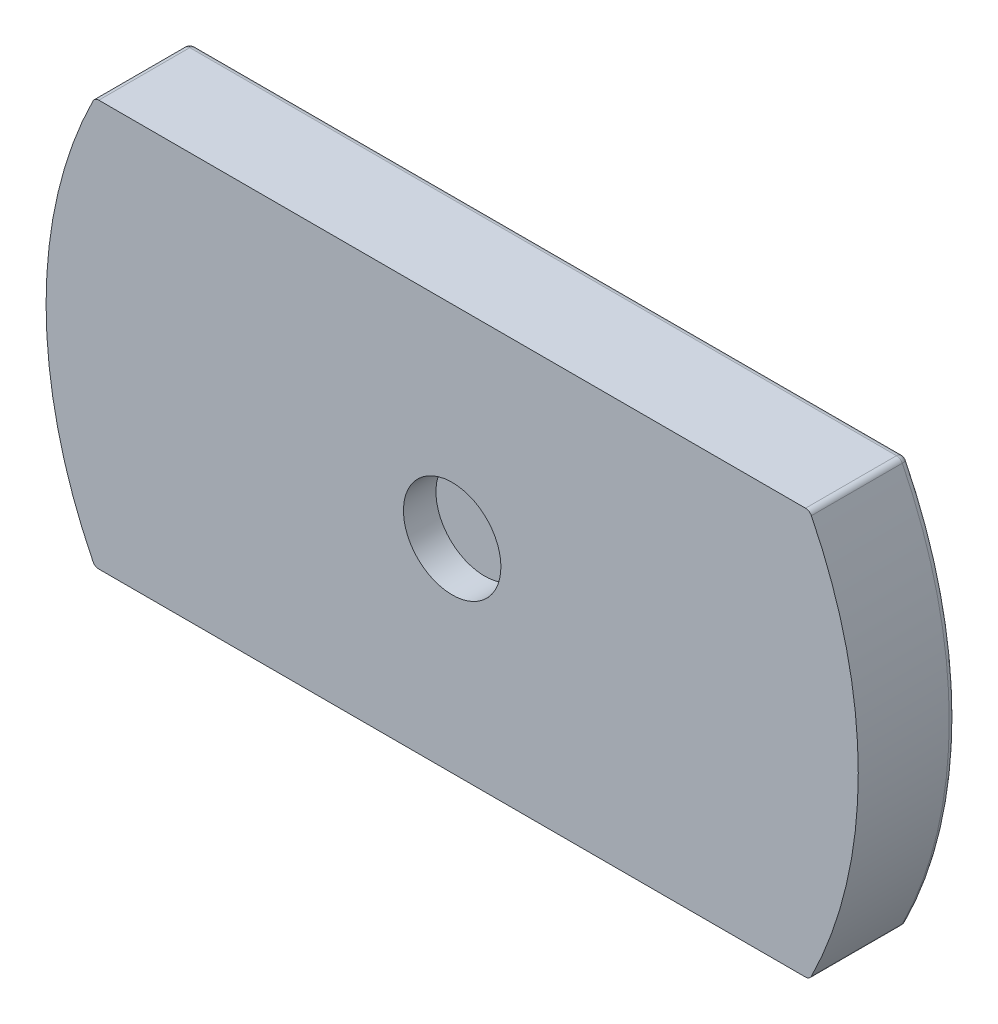
from build123d import *

# Parameters (mm, degrees)
SKETCH1_W                   = 635
SKETCH1_H                   = 317.5
BOSS_EXTRUDE2_DEPTH         = 76.2
SKETCH3_OUTSIDE_W           = 779.806
SKETCH3_OUTSIDE_H           = 462.306
CUT_EXTRUDE1_DEPTH          = 137.16
FILLET1_R                   = 5.08
SKETCH5_R                   = 6.35
CUT_EXTRUDE2_DEPTH          = 20.32
LPATTERN1_COUNT             = 18
LPATTERN1_PITCH             = 30.48
LPATTERN2_COUNT             = 9
LPATTERN2_PITCH             = 31.75
LPATTERN2_COPY_1_SKETCH_R   = 6.35
LPATTERN2_COPY_1_DEPTH      = 20.32
LPATTERN2_COPY_2_SKETCH_R   = 6.35
LPATTERN2_COPY_2_DEPTH      = 20.32
LPATTERN2_COPY_3_SKETCH_R   = 6.35
LPATTERN2_COPY_3_DEPTH      = 20.32
LPATTERN2_COPY_4_SKETCH_R   = 6.35
LPATTERN2_COPY_4_DEPTH      = 20.32
LPATTERN2_COPY_5_SKETCH_R   = 6.35
LPATTERN2_COPY_5_DEPTH      = 20.32
LPATTERN2_COPY_6_SKETCH_R   = 6.35
LPATTERN2_COPY_6_DEPTH      = 20.32
LPATTERN2_COPY_7_SKETCH_R   = 6.35
LPATTERN2_COPY_7_DEPTH      = 20.32
LPATTERN2_COPY_8_SKETCH_R   = 6.35
LPATTERN2_COPY_8_DEPTH      = 20.32
LPATTERN2_COPY_9_SKETCH_R   = 6.35
LPATTERN2_COPY_9_DEPTH      = 20.32
LPATTERN2_COPY_10_SKETCH_R  = 6.35
LPATTERN2_COPY_10_DEPTH     = 20.32
LPATTERN2_COPY_11_SKETCH_R  = 6.35
LPATTERN2_COPY_11_DEPTH     = 20.32
LPATTERN2_COPY_12_SKETCH_R  = 6.35
LPATTERN2_COPY_12_DEPTH     = 20.32
LPATTERN2_COPY_13_SKETCH_R  = 6.35
LPATTERN2_COPY_13_DEPTH     = 20.32
LPATTERN2_COPY_14_SKETCH_R  = 6.35
LPATTERN2_COPY_14_DEPTH     = 20.32
LPATTERN2_COPY_15_SKETCH_R  = 6.35
LPATTERN2_COPY_15_DEPTH     = 20.32
LPATTERN2_COPY_16_SKETCH_R  = 6.35
LPATTERN2_COPY_16_DEPTH     = 20.32
LPATTERN2_COPY_17_SKETCH_R  = 6.35
LPATTERN2_COPY_17_DEPTH     = 20.32
LPATTERN2_COPY_18_SKETCH_R  = 6.35
LPATTERN2_COPY_18_DEPTH     = 20.32
LPATTERN2_COPY_19_SKETCH_R  = 6.35
LPATTERN2_COPY_19_DEPTH     = 20.32
LPATTERN2_COPY_20_SKETCH_R  = 6.35
LPATTERN2_COPY_20_DEPTH     = 20.32
LPATTERN2_COPY_21_SKETCH_R  = 6.35
LPATTERN2_COPY_21_DEPTH     = 20.32
LPATTERN2_COPY_22_SKETCH_R  = 6.35
LPATTERN2_COPY_22_DEPTH     = 20.32
LPATTERN2_COPY_23_SKETCH_R  = 6.35
LPATTERN2_COPY_23_DEPTH     = 20.32
LPATTERN2_COPY_24_SKETCH_R  = 6.35
LPATTERN2_COPY_24_DEPTH     = 20.32
LPATTERN2_COPY_25_SKETCH_R  = 6.35
LPATTERN2_COPY_25_DEPTH     = 20.32
LPATTERN2_COPY_26_SKETCH_R  = 6.35
LPATTERN2_COPY_26_DEPTH     = 20.32
LPATTERN2_COPY_27_SKETCH_R  = 6.35
LPATTERN2_COPY_27_DEPTH     = 20.32
LPATTERN2_COPY_28_SKETCH_R  = 6.35
LPATTERN2_COPY_28_DEPTH     = 20.32
LPATTERN2_COPY_29_SKETCH_R  = 6.35
LPATTERN2_COPY_29_DEPTH     = 20.32
LPATTERN2_COPY_30_SKETCH_R  = 6.35
LPATTERN2_COPY_30_DEPTH     = 20.32
LPATTERN2_COPY_31_SKETCH_R  = 6.35
LPATTERN2_COPY_31_DEPTH     = 20.32
LPATTERN2_COPY_32_SKETCH_R  = 6.35
LPATTERN2_COPY_32_DEPTH     = 20.32
LPATTERN2_COPY_33_SKETCH_R  = 6.35
LPATTERN2_COPY_33_DEPTH     = 20.32
LPATTERN2_COPY_34_SKETCH_R  = 6.35
LPATTERN2_COPY_34_DEPTH     = 20.32
LPATTERN2_COPY_35_SKETCH_R  = 6.35
LPATTERN2_COPY_35_DEPTH     = 20.32
LPATTERN2_COPY_36_SKETCH_R  = 6.35
LPATTERN2_COPY_36_DEPTH     = 20.32
LPATTERN2_COPY_37_SKETCH_R  = 6.35
LPATTERN2_COPY_37_DEPTH     = 20.32
LPATTERN2_COPY_38_SKETCH_R  = 6.35
LPATTERN2_COPY_38_DEPTH     = 20.32
LPATTERN2_COPY_39_SKETCH_R  = 6.35
LPATTERN2_COPY_39_DEPTH     = 20.32
LPATTERN2_COPY_40_SKETCH_R  = 6.35
LPATTERN2_COPY_40_DEPTH     = 20.32
LPATTERN2_COPY_41_SKETCH_R  = 6.35
LPATTERN2_COPY_41_DEPTH     = 20.32
LPATTERN2_COPY_42_SKETCH_R  = 6.35
LPATTERN2_COPY_42_DEPTH     = 20.32
LPATTERN2_COPY_43_SKETCH_R  = 6.35
LPATTERN2_COPY_43_DEPTH     = 20.32
LPATTERN2_COPY_44_SKETCH_R  = 6.35
LPATTERN2_COPY_44_DEPTH     = 20.32
LPATTERN2_COPY_45_SKETCH_R  = 6.35
LPATTERN2_COPY_45_DEPTH     = 20.32
LPATTERN2_COPY_46_SKETCH_R  = 6.35
LPATTERN2_COPY_46_DEPTH     = 20.32
LPATTERN2_COPY_47_SKETCH_R  = 6.35
LPATTERN2_COPY_47_DEPTH     = 20.32
LPATTERN2_COPY_48_SKETCH_R  = 6.35
LPATTERN2_COPY_48_DEPTH     = 20.32
LPATTERN2_COPY_49_SKETCH_R  = 6.35
LPATTERN2_COPY_49_DEPTH     = 20.32
LPATTERN2_COPY_50_SKETCH_R  = 6.35
LPATTERN2_COPY_50_DEPTH     = 20.32
LPATTERN2_COPY_51_SKETCH_R  = 6.35
LPATTERN2_COPY_51_DEPTH     = 20.32
LPATTERN2_COPY_52_SKETCH_R  = 6.35
LPATTERN2_COPY_52_DEPTH     = 20.32
LPATTERN2_COPY_53_SKETCH_R  = 6.35
LPATTERN2_COPY_53_DEPTH     = 20.32
LPATTERN2_COPY_54_SKETCH_R  = 6.35
LPATTERN2_COPY_54_DEPTH     = 20.32
LPATTERN2_COPY_55_SKETCH_R  = 6.35
LPATTERN2_COPY_55_DEPTH     = 20.32
LPATTERN2_COPY_56_SKETCH_R  = 6.35
LPATTERN2_COPY_56_DEPTH     = 20.32
LPATTERN2_COPY_57_SKETCH_R  = 6.35
LPATTERN2_COPY_57_DEPTH     = 20.32
LPATTERN2_COPY_58_SKETCH_R  = 6.35
LPATTERN2_COPY_58_DEPTH     = 20.32
LPATTERN2_COPY_59_SKETCH_R  = 6.35
LPATTERN2_COPY_59_DEPTH     = 20.32
LPATTERN2_COPY_60_SKETCH_R  = 6.35
LPATTERN2_COPY_60_DEPTH     = 20.32
LPATTERN2_COPY_61_SKETCH_R  = 6.35
LPATTERN2_COPY_61_DEPTH     = 20.32
LPATTERN2_COPY_62_SKETCH_R  = 6.35
LPATTERN2_COPY_62_DEPTH     = 20.32
LPATTERN2_COPY_63_SKETCH_R  = 6.35
LPATTERN2_COPY_63_DEPTH     = 20.32
LPATTERN2_COPY_64_SKETCH_R  = 6.35
LPATTERN2_COPY_64_DEPTH     = 20.32
LPATTERN2_COPY_65_SKETCH_R  = 6.35
LPATTERN2_COPY_65_DEPTH     = 20.32
LPATTERN2_COPY_66_SKETCH_R  = 6.35
LPATTERN2_COPY_66_DEPTH     = 20.32
LPATTERN2_COPY_67_SKETCH_R  = 6.35
LPATTERN2_COPY_67_DEPTH     = 20.32
LPATTERN2_COPY_68_SKETCH_R  = 6.35
LPATTERN2_COPY_68_DEPTH     = 20.32
LPATTERN2_COPY_69_SKETCH_R  = 6.35
LPATTERN2_COPY_69_DEPTH     = 20.32
LPATTERN2_COPY_70_SKETCH_R  = 6.35
LPATTERN2_COPY_70_DEPTH     = 20.32
LPATTERN2_COPY_71_SKETCH_R  = 6.35
LPATTERN2_COPY_71_DEPTH     = 20.32
LPATTERN2_COPY_72_SKETCH_R  = 6.35
LPATTERN2_COPY_72_DEPTH     = 20.32
LPATTERN2_COPY_73_SKETCH_R  = 6.35
LPATTERN2_COPY_73_DEPTH     = 20.32
LPATTERN2_COPY_74_SKETCH_R  = 6.35
LPATTERN2_COPY_74_DEPTH     = 20.32
LPATTERN2_COPY_75_SKETCH_R  = 6.35
LPATTERN2_COPY_75_DEPTH     = 20.32
LPATTERN2_COPY_76_SKETCH_R  = 6.35
LPATTERN2_COPY_76_DEPTH     = 20.32
LPATTERN2_COPY_77_SKETCH_R  = 6.35
LPATTERN2_COPY_77_DEPTH     = 20.32
LPATTERN2_COPY_78_SKETCH_R  = 6.35
LPATTERN2_COPY_78_DEPTH     = 20.32
LPATTERN2_COPY_79_SKETCH_R  = 6.35
LPATTERN2_COPY_79_DEPTH     = 20.32
LPATTERN2_COPY_80_SKETCH_R  = 6.35
LPATTERN2_COPY_80_DEPTH     = 20.32
LPATTERN2_COPY_81_SKETCH_R  = 6.35
LPATTERN2_COPY_81_DEPTH     = 20.32
LPATTERN2_COPY_82_SKETCH_R  = 6.35
LPATTERN2_COPY_82_DEPTH     = 20.32
LPATTERN2_COPY_83_SKETCH_R  = 6.35
LPATTERN2_COPY_83_DEPTH     = 20.32
LPATTERN2_COPY_84_SKETCH_R  = 6.35
LPATTERN2_COPY_84_DEPTH     = 20.32
LPATTERN2_COPY_85_SKETCH_R  = 6.35
LPATTERN2_COPY_85_DEPTH     = 20.32
LPATTERN2_COPY_86_SKETCH_R  = 6.35
LPATTERN2_COPY_86_DEPTH     = 20.32
LPATTERN2_COPY_87_SKETCH_R  = 6.35
LPATTERN2_COPY_87_DEPTH     = 20.32
LPATTERN2_COPY_88_SKETCH_R  = 6.35
LPATTERN2_COPY_88_DEPTH     = 20.32
LPATTERN2_COPY_89_SKETCH_R  = 6.35
LPATTERN2_COPY_89_DEPTH     = 20.32
LPATTERN2_COPY_90_SKETCH_R  = 6.35
LPATTERN2_COPY_90_DEPTH     = 20.32
LPATTERN2_COPY_91_SKETCH_R  = 6.35
LPATTERN2_COPY_91_DEPTH     = 20.32
LPATTERN2_COPY_92_SKETCH_R  = 6.35
LPATTERN2_COPY_92_DEPTH     = 20.32
LPATTERN2_COPY_93_SKETCH_R  = 6.35
LPATTERN2_COPY_93_DEPTH     = 20.32
LPATTERN2_COPY_94_SKETCH_R  = 6.35
LPATTERN2_COPY_94_DEPTH     = 20.32
LPATTERN2_COPY_95_SKETCH_R  = 6.35
LPATTERN2_COPY_95_DEPTH     = 20.32
LPATTERN2_COPY_96_SKETCH_R  = 6.35
LPATTERN2_COPY_96_DEPTH     = 20.32
LPATTERN2_COPY_97_SKETCH_R  = 6.35
LPATTERN2_COPY_97_DEPTH     = 20.32
LPATTERN2_COPY_98_SKETCH_R  = 6.35
LPATTERN2_COPY_98_DEPTH     = 20.32
LPATTERN2_COPY_99_SKETCH_R  = 6.35
LPATTERN2_COPY_99_DEPTH     = 20.32
LPATTERN2_COPY_100_SKETCH_R = 6.35
LPATTERN2_COPY_100_DEPTH    = 20.32
LPATTERN2_COPY_101_SKETCH_R = 6.35
LPATTERN2_COPY_101_DEPTH    = 20.32
LPATTERN2_COPY_102_SKETCH_R = 6.35
LPATTERN2_COPY_102_DEPTH    = 20.32
LPATTERN2_COPY_103_SKETCH_R = 6.35
LPATTERN2_COPY_103_DEPTH    = 20.32
LPATTERN2_COPY_104_SKETCH_R = 6.35
LPATTERN2_COPY_104_DEPTH    = 20.32
LPATTERN2_COPY_105_SKETCH_R = 6.35
LPATTERN2_COPY_105_DEPTH    = 20.32
LPATTERN2_COPY_106_SKETCH_R = 6.35
LPATTERN2_COPY_106_DEPTH    = 20.32
LPATTERN2_COPY_107_SKETCH_R = 6.35
LPATTERN2_COPY_107_DEPTH    = 20.32
LPATTERN2_COPY_108_SKETCH_R = 6.35
LPATTERN2_COPY_108_DEPTH    = 20.32
LPATTERN2_COPY_109_SKETCH_R = 6.35
LPATTERN2_COPY_109_DEPTH    = 20.32
LPATTERN2_COPY_110_SKETCH_R = 6.35
LPATTERN2_COPY_110_DEPTH    = 20.32
LPATTERN2_COPY_111_SKETCH_R = 6.35
LPATTERN2_COPY_111_DEPTH    = 20.32
LPATTERN2_COPY_112_SKETCH_R = 6.35
LPATTERN2_COPY_112_DEPTH    = 20.32
LPATTERN2_COPY_113_SKETCH_R = 6.35
LPATTERN2_COPY_113_DEPTH    = 20.32
LPATTERN2_COPY_114_SKETCH_R = 6.35
LPATTERN2_COPY_114_DEPTH    = 20.32
LPATTERN2_COPY_115_SKETCH_R = 6.35
LPATTERN2_COPY_115_DEPTH    = 20.32
LPATTERN2_COPY_116_SKETCH_R = 6.35
LPATTERN2_COPY_116_DEPTH    = 20.32
LPATTERN2_COPY_117_SKETCH_R = 6.35
LPATTERN2_COPY_117_DEPTH    = 20.32
LPATTERN2_COPY_118_SKETCH_R = 6.35
LPATTERN2_COPY_118_DEPTH    = 20.32
LPATTERN2_COPY_119_SKETCH_R = 6.35
LPATTERN2_COPY_119_DEPTH    = 20.32
LPATTERN2_COPY_120_SKETCH_R = 6.35
LPATTERN2_COPY_120_DEPTH    = 20.32
LPATTERN2_COPY_121_SKETCH_R = 6.35
LPATTERN2_COPY_121_DEPTH    = 20.32
LPATTERN2_COPY_122_SKETCH_R = 6.35
LPATTERN2_COPY_122_DEPTH    = 20.32
LPATTERN2_COPY_123_SKETCH_R = 6.35
LPATTERN2_COPY_123_DEPTH    = 20.32
LPATTERN2_COPY_124_SKETCH_R = 6.35
LPATTERN2_COPY_124_DEPTH    = 20.32
LPATTERN2_COPY_125_SKETCH_R = 6.35
LPATTERN2_COPY_125_DEPTH    = 20.32
LPATTERN2_COPY_126_SKETCH_R = 6.35
LPATTERN2_COPY_126_DEPTH    = 20.32
LPATTERN2_COPY_127_SKETCH_R = 6.35
LPATTERN2_COPY_127_DEPTH    = 20.32
LPATTERN2_COPY_128_SKETCH_R = 6.35
LPATTERN2_COPY_128_DEPTH    = 20.32
LPATTERN2_COPY_129_SKETCH_R = 6.35
LPATTERN2_COPY_129_DEPTH    = 20.32
LPATTERN2_COPY_130_SKETCH_R = 6.35
LPATTERN2_COPY_130_DEPTH    = 20.32
LPATTERN2_COPY_131_SKETCH_R = 6.35
LPATTERN2_COPY_131_DEPTH    = 20.32
LPATTERN2_COPY_132_SKETCH_R = 6.35
LPATTERN2_COPY_132_DEPTH    = 20.32
LPATTERN2_COPY_133_SKETCH_R = 6.35
LPATTERN2_COPY_133_DEPTH    = 20.32
LPATTERN2_COPY_134_SKETCH_R = 6.35
LPATTERN2_COPY_134_DEPTH    = 20.32
LPATTERN2_COPY_135_SKETCH_R = 6.35
LPATTERN2_COPY_135_DEPTH    = 20.32
LPATTERN2_COPY_136_SKETCH_R = 6.35
LPATTERN2_COPY_136_DEPTH    = 20.32
CIRPATTERN1_COUNT           = 6
CIRPATTERN1_ANGLE           = 40
MIRROR1_COPY_1_SKETCH_R     = 6.35
MIRROR1_COPY_1_DEPTH        = 20.32
MIRROR1_COPY_2_SKETCH_R     = 6.35
MIRROR1_COPY_2_DEPTH        = 20.32
MIRROR1_COPY_3_SKETCH_R     = 6.35
MIRROR1_COPY_3_DEPTH        = 20.32
MIRROR1_COPY_4_SKETCH_R     = 6.35
MIRROR1_COPY_4_DEPTH        = 20.32
MIRROR1_COPY_5_SKETCH_R     = 6.35
MIRROR1_COPY_5_DEPTH        = 20.32
MIRROR1_COPY_6_SKETCH_R     = 6.35
MIRROR1_COPY_6_DEPTH        = 20.32
SKETCH8_R                   = 38.1
CUT_EXTRUDE3_DEPTH          = 25.4


with BuildPart() as part:
    # Sketch1 → Boss-Extrude2 (new body)
    with BuildSketch(Plane.XY):
        with Locations((0, 234.95)):
            Rectangle(SKETCH1_W, SKETCH1_H)
    extrude(amount=BOSS_EXTRUDE2_DEPTH)

    # Sketch3 outside → Cut-Extrude1 (cut)
    with BuildSketch(Plane.XY.offset(76.2)):
        with Locations((0, 234.95)):
            Rectangle(SKETCH3_OUTSIDE_W, SKETCH3_OUTSIDE_H)
        with BuildLine():
            Line((-279.4, 393.7), (279.4, 393.7))
            ThreePointArc((279.4, 393.7), (317.5, 234.95), (279.4, 76.2))
            Line((279.4, 76.2), (-279.4, 76.2))
            ThreePointArc((-279.4, 76.2), (-317.5, 234.95), (-279.4, 393.7))
        make_face(mode=Mode.SUBTRACT)
    extrude(amount=-CUT_EXTRUDE1_DEPTH, mode=Mode.SUBTRACT)

    # Fillet1
    fillet1_edges = [part.edges().sort_by_distance(p)[0] for p in [
        (279.4, 393.7, 38.1),
        (-279.4, 393.7, 38.1),
        (-279.4, 76.2, 38.1),
        (279.4, 76.2, 38.1),
        (-317.5, 234.95, 0),
        (0, 393.7, 0),
        (317.5, 234.95, 0),
        (0, 76.2, 0),
    ]]
    fillet(fillet1_edges, radius=FILLET1_R)

    # Sketch5 → Cut-Extrude2 (cut)
    with BuildSketch(Plane(origin=(0, 0, 0), x_dir=(-1, 0, 0), z_dir=(0, 0, -1))):
        with Locations((-260.122551752, 106.68)):
            Circle(SKETCH5_R)
    cut_extrude2 = extrude(amount=-CUT_EXTRUDE2_DEPTH, mode=Mode.SUBTRACT)

    # LPattern1: Cut-Extrude2 ×18
    with Locations(*[(-i * LPATTERN1_PITCH, 0, 0) for i in range(1, LPATTERN1_COUNT)]):
        add(cut_extrude2, mode=Mode.SUBTRACT)

    # LPattern2: Cut-Extrude2 ×9
    with Locations(*[(0, i * LPATTERN2_PITCH, 0) for i in range(1, LPATTERN2_COUNT)]):
        add(cut_extrude2, mode=Mode.SUBTRACT)

    # LPattern2 copy 1 sketch → LPattern2 copy 1 (cut)
    with BuildSketch(Plane(origin=(-30.48, 31.75, 0), x_dir=(-1, 0, 0), z_dir=(0, 0, -1))):
        with Locations((-260.122551752, 106.68)):
            Circle(LPATTERN2_COPY_1_SKETCH_R)
    extrude(amount=-LPATTERN2_COPY_1_DEPTH, mode=Mode.SUBTRACT)

    # LPattern2 copy 2 sketch → LPattern2 copy 2 (cut)
    with BuildSketch(Plane(origin=(-30.48, 63.5, 0), x_dir=(-1, 0, 0), z_dir=(0, 0, -1))):
        with Locations((-260.122551752, 106.68)):
            Circle(LPATTERN2_COPY_2_SKETCH_R)
    extrude(amount=-LPATTERN2_COPY_2_DEPTH, mode=Mode.SUBTRACT)

    # LPattern2 copy 3 sketch → LPattern2 copy 3 (cut)
    with BuildSketch(Plane(origin=(-30.48, 95.25, 0), x_dir=(-1, 0, 0), z_dir=(0, 0, -1))):
        with Locations((-260.122551752, 106.68)):
            Circle(LPATTERN2_COPY_3_SKETCH_R)
    extrude(amount=-LPATTERN2_COPY_3_DEPTH, mode=Mode.SUBTRACT)

    # LPattern2 copy 4 sketch → LPattern2 copy 4 (cut)
    with BuildSketch(Plane(origin=(-30.48, 127, 0), x_dir=(-1, 0, 0), z_dir=(0, 0, -1))):
        with Locations((-260.122551752, 106.68)):
            Circle(LPATTERN2_COPY_4_SKETCH_R)
    extrude(amount=-LPATTERN2_COPY_4_DEPTH, mode=Mode.SUBTRACT)

    # LPattern2 copy 5 sketch → LPattern2 copy 5 (cut)
    with BuildSketch(Plane(origin=(-30.48, 158.75, 0), x_dir=(-1, 0, 0), z_dir=(0, 0, -1))):
        with Locations((-260.122551752, 106.68)):
            Circle(LPATTERN2_COPY_5_SKETCH_R)
    extrude(amount=-LPATTERN2_COPY_5_DEPTH, mode=Mode.SUBTRACT)

    # LPattern2 copy 6 sketch → LPattern2 copy 6 (cut)
    with BuildSketch(Plane(origin=(-30.48, 190.5, 0), x_dir=(-1, 0, 0), z_dir=(0, 0, -1))):
        with Locations((-260.122551752, 106.68)):
            Circle(LPATTERN2_COPY_6_SKETCH_R)
    extrude(amount=-LPATTERN2_COPY_6_DEPTH, mode=Mode.SUBTRACT)

    # LPattern2 copy 7 sketch → LPattern2 copy 7 (cut)
    with BuildSketch(Plane(origin=(-30.48, 222.25, 0), x_dir=(-1, 0, 0), z_dir=(0, 0, -1))):
        with Locations((-260.122551752, 106.68)):
            Circle(LPATTERN2_COPY_7_SKETCH_R)
    extrude(amount=-LPATTERN2_COPY_7_DEPTH, mode=Mode.SUBTRACT)

    # LPattern2 copy 8 sketch → LPattern2 copy 8 (cut)
    with BuildSketch(Plane(origin=(-30.48, 254, 0), x_dir=(-1, 0, 0), z_dir=(0, 0, -1))):
        with Locations((-260.122551752, 106.68)):
            Circle(LPATTERN2_COPY_8_SKETCH_R)
    extrude(amount=-LPATTERN2_COPY_8_DEPTH, mode=Mode.SUBTRACT)

    # LPattern2 copy 9 sketch → LPattern2 copy 9 (cut)
    with BuildSketch(Plane(origin=(-60.96, 31.75, 0), x_dir=(-1, 0, 0), z_dir=(0, 0, -1))):
        with Locations((-260.122551752, 106.68)):
            Circle(LPATTERN2_COPY_9_SKETCH_R)
    extrude(amount=-LPATTERN2_COPY_9_DEPTH, mode=Mode.SUBTRACT)

    # LPattern2 copy 10 sketch → LPattern2 copy 10 (cut)
    with BuildSketch(Plane(origin=(-60.96, 63.5, 0), x_dir=(-1, 0, 0), z_dir=(0, 0, -1))):
        with Locations((-260.122551752, 106.68)):
            Circle(LPATTERN2_COPY_10_SKETCH_R)
    extrude(amount=-LPATTERN2_COPY_10_DEPTH, mode=Mode.SUBTRACT)

    # LPattern2 copy 11 sketch → LPattern2 copy 11 (cut)
    with BuildSketch(Plane(origin=(-60.96, 95.25, 0), x_dir=(-1, 0, 0), z_dir=(0, 0, -1))):
        with Locations((-260.122551752, 106.68)):
            Circle(LPATTERN2_COPY_11_SKETCH_R)
    extrude(amount=-LPATTERN2_COPY_11_DEPTH, mode=Mode.SUBTRACT)

    # LPattern2 copy 12 sketch → LPattern2 copy 12 (cut)
    with BuildSketch(Plane(origin=(-60.96, 127, 0), x_dir=(-1, 0, 0), z_dir=(0, 0, -1))):
        with Locations((-260.122551752, 106.68)):
            Circle(LPATTERN2_COPY_12_SKETCH_R)
    extrude(amount=-LPATTERN2_COPY_12_DEPTH, mode=Mode.SUBTRACT)

    # LPattern2 copy 13 sketch → LPattern2 copy 13 (cut)
    with BuildSketch(Plane(origin=(-60.96, 158.75, 0), x_dir=(-1, 0, 0), z_dir=(0, 0, -1))):
        with Locations((-260.122551752, 106.68)):
            Circle(LPATTERN2_COPY_13_SKETCH_R)
    extrude(amount=-LPATTERN2_COPY_13_DEPTH, mode=Mode.SUBTRACT)

    # LPattern2 copy 14 sketch → LPattern2 copy 14 (cut)
    with BuildSketch(Plane(origin=(-60.96, 190.5, 0), x_dir=(-1, 0, 0), z_dir=(0, 0, -1))):
        with Locations((-260.122551752, 106.68)):
            Circle(LPATTERN2_COPY_14_SKETCH_R)
    extrude(amount=-LPATTERN2_COPY_14_DEPTH, mode=Mode.SUBTRACT)

    # LPattern2 copy 15 sketch → LPattern2 copy 15 (cut)
    with BuildSketch(Plane(origin=(-60.96, 222.25, 0), x_dir=(-1, 0, 0), z_dir=(0, 0, -1))):
        with Locations((-260.122551752, 106.68)):
            Circle(LPATTERN2_COPY_15_SKETCH_R)
    extrude(amount=-LPATTERN2_COPY_15_DEPTH, mode=Mode.SUBTRACT)

    # LPattern2 copy 16 sketch → LPattern2 copy 16 (cut)
    with BuildSketch(Plane(origin=(-60.96, 254, 0), x_dir=(-1, 0, 0), z_dir=(0, 0, -1))):
        with Locations((-260.122551752, 106.68)):
            Circle(LPATTERN2_COPY_16_SKETCH_R)
    extrude(amount=-LPATTERN2_COPY_16_DEPTH, mode=Mode.SUBTRACT)

    # LPattern2 copy 17 sketch → LPattern2 copy 17 (cut)
    with BuildSketch(Plane(origin=(-91.44, 31.75, 0), x_dir=(-1, 0, 0), z_dir=(0, 0, -1))):
        with Locations((-260.122551752, 106.68)):
            Circle(LPATTERN2_COPY_17_SKETCH_R)
    extrude(amount=-LPATTERN2_COPY_17_DEPTH, mode=Mode.SUBTRACT)

    # LPattern2 copy 18 sketch → LPattern2 copy 18 (cut)
    with BuildSketch(Plane(origin=(-91.44, 63.5, 0), x_dir=(-1, 0, 0), z_dir=(0, 0, -1))):
        with Locations((-260.122551752, 106.68)):
            Circle(LPATTERN2_COPY_18_SKETCH_R)
    extrude(amount=-LPATTERN2_COPY_18_DEPTH, mode=Mode.SUBTRACT)

    # LPattern2 copy 19 sketch → LPattern2 copy 19 (cut)
    with BuildSketch(Plane(origin=(-91.44, 95.25, 0), x_dir=(-1, 0, 0), z_dir=(0, 0, -1))):
        with Locations((-260.122551752, 106.68)):
            Circle(LPATTERN2_COPY_19_SKETCH_R)
    extrude(amount=-LPATTERN2_COPY_19_DEPTH, mode=Mode.SUBTRACT)

    # LPattern2 copy 20 sketch → LPattern2 copy 20 (cut)
    with BuildSketch(Plane(origin=(-91.44, 127, 0), x_dir=(-1, 0, 0), z_dir=(0, 0, -1))):
        with Locations((-260.122551752, 106.68)):
            Circle(LPATTERN2_COPY_20_SKETCH_R)
    extrude(amount=-LPATTERN2_COPY_20_DEPTH, mode=Mode.SUBTRACT)

    # LPattern2 copy 21 sketch → LPattern2 copy 21 (cut)
    with BuildSketch(Plane(origin=(-91.44, 158.75, 0), x_dir=(-1, 0, 0), z_dir=(0, 0, -1))):
        with Locations((-260.122551752, 106.68)):
            Circle(LPATTERN2_COPY_21_SKETCH_R)
    extrude(amount=-LPATTERN2_COPY_21_DEPTH, mode=Mode.SUBTRACT)

    # LPattern2 copy 22 sketch → LPattern2 copy 22 (cut)
    with BuildSketch(Plane(origin=(-91.44, 190.5, 0), x_dir=(-1, 0, 0), z_dir=(0, 0, -1))):
        with Locations((-260.122551752, 106.68)):
            Circle(LPATTERN2_COPY_22_SKETCH_R)
    extrude(amount=-LPATTERN2_COPY_22_DEPTH, mode=Mode.SUBTRACT)

    # LPattern2 copy 23 sketch → LPattern2 copy 23 (cut)
    with BuildSketch(Plane(origin=(-91.44, 222.25, 0), x_dir=(-1, 0, 0), z_dir=(0, 0, -1))):
        with Locations((-260.122551752, 106.68)):
            Circle(LPATTERN2_COPY_23_SKETCH_R)
    extrude(amount=-LPATTERN2_COPY_23_DEPTH, mode=Mode.SUBTRACT)

    # LPattern2 copy 24 sketch → LPattern2 copy 24 (cut)
    with BuildSketch(Plane(origin=(-91.44, 254, 0), x_dir=(-1, 0, 0), z_dir=(0, 0, -1))):
        with Locations((-260.122551752, 106.68)):
            Circle(LPATTERN2_COPY_24_SKETCH_R)
    extrude(amount=-LPATTERN2_COPY_24_DEPTH, mode=Mode.SUBTRACT)

    # LPattern2 copy 25 sketch → LPattern2 copy 25 (cut)
    with BuildSketch(Plane(origin=(-121.92, 31.75, 0), x_dir=(-1, 0, 0), z_dir=(0, 0, -1))):
        with Locations((-260.122551752, 106.68)):
            Circle(LPATTERN2_COPY_25_SKETCH_R)
    extrude(amount=-LPATTERN2_COPY_25_DEPTH, mode=Mode.SUBTRACT)

    # LPattern2 copy 26 sketch → LPattern2 copy 26 (cut)
    with BuildSketch(Plane(origin=(-121.92, 63.5, 0), x_dir=(-1, 0, 0), z_dir=(0, 0, -1))):
        with Locations((-260.122551752, 106.68)):
            Circle(LPATTERN2_COPY_26_SKETCH_R)
    extrude(amount=-LPATTERN2_COPY_26_DEPTH, mode=Mode.SUBTRACT)

    # LPattern2 copy 27 sketch → LPattern2 copy 27 (cut)
    with BuildSketch(Plane(origin=(-121.92, 95.25, 0), x_dir=(-1, 0, 0), z_dir=(0, 0, -1))):
        with Locations((-260.122551752, 106.68)):
            Circle(LPATTERN2_COPY_27_SKETCH_R)
    extrude(amount=-LPATTERN2_COPY_27_DEPTH, mode=Mode.SUBTRACT)

    # LPattern2 copy 28 sketch → LPattern2 copy 28 (cut)
    with BuildSketch(Plane(origin=(-121.92, 127, 0), x_dir=(-1, 0, 0), z_dir=(0, 0, -1))):
        with Locations((-260.122551752, 106.68)):
            Circle(LPATTERN2_COPY_28_SKETCH_R)
    extrude(amount=-LPATTERN2_COPY_28_DEPTH, mode=Mode.SUBTRACT)

    # LPattern2 copy 29 sketch → LPattern2 copy 29 (cut)
    with BuildSketch(Plane(origin=(-121.92, 158.75, 0), x_dir=(-1, 0, 0), z_dir=(0, 0, -1))):
        with Locations((-260.122551752, 106.68)):
            Circle(LPATTERN2_COPY_29_SKETCH_R)
    extrude(amount=-LPATTERN2_COPY_29_DEPTH, mode=Mode.SUBTRACT)

    # LPattern2 copy 30 sketch → LPattern2 copy 30 (cut)
    with BuildSketch(Plane(origin=(-121.92, 190.5, 0), x_dir=(-1, 0, 0), z_dir=(0, 0, -1))):
        with Locations((-260.122551752, 106.68)):
            Circle(LPATTERN2_COPY_30_SKETCH_R)
    extrude(amount=-LPATTERN2_COPY_30_DEPTH, mode=Mode.SUBTRACT)

    # LPattern2 copy 31 sketch → LPattern2 copy 31 (cut)
    with BuildSketch(Plane(origin=(-121.92, 222.25, 0), x_dir=(-1, 0, 0), z_dir=(0, 0, -1))):
        with Locations((-260.122551752, 106.68)):
            Circle(LPATTERN2_COPY_31_SKETCH_R)
    extrude(amount=-LPATTERN2_COPY_31_DEPTH, mode=Mode.SUBTRACT)

    # LPattern2 copy 32 sketch → LPattern2 copy 32 (cut)
    with BuildSketch(Plane(origin=(-121.92, 254, 0), x_dir=(-1, 0, 0), z_dir=(0, 0, -1))):
        with Locations((-260.122551752, 106.68)):
            Circle(LPATTERN2_COPY_32_SKETCH_R)
    extrude(amount=-LPATTERN2_COPY_32_DEPTH, mode=Mode.SUBTRACT)

    # LPattern2 copy 33 sketch → LPattern2 copy 33 (cut)
    with BuildSketch(Plane(origin=(-152.4, 31.75, 0), x_dir=(-1, 0, 0), z_dir=(0, 0, -1))):
        with Locations((-260.122551752, 106.68)):
            Circle(LPATTERN2_COPY_33_SKETCH_R)
    extrude(amount=-LPATTERN2_COPY_33_DEPTH, mode=Mode.SUBTRACT)

    # LPattern2 copy 34 sketch → LPattern2 copy 34 (cut)
    with BuildSketch(Plane(origin=(-152.4, 63.5, 0), x_dir=(-1, 0, 0), z_dir=(0, 0, -1))):
        with Locations((-260.122551752, 106.68)):
            Circle(LPATTERN2_COPY_34_SKETCH_R)
    extrude(amount=-LPATTERN2_COPY_34_DEPTH, mode=Mode.SUBTRACT)

    # LPattern2 copy 35 sketch → LPattern2 copy 35 (cut)
    with BuildSketch(Plane(origin=(-152.4, 95.25, 0), x_dir=(-1, 0, 0), z_dir=(0, 0, -1))):
        with Locations((-260.122551752, 106.68)):
            Circle(LPATTERN2_COPY_35_SKETCH_R)
    extrude(amount=-LPATTERN2_COPY_35_DEPTH, mode=Mode.SUBTRACT)

    # LPattern2 copy 36 sketch → LPattern2 copy 36 (cut)
    with BuildSketch(Plane(origin=(-152.4, 127, 0), x_dir=(-1, 0, 0), z_dir=(0, 0, -1))):
        with Locations((-260.122551752, 106.68)):
            Circle(LPATTERN2_COPY_36_SKETCH_R)
    extrude(amount=-LPATTERN2_COPY_36_DEPTH, mode=Mode.SUBTRACT)

    # LPattern2 copy 37 sketch → LPattern2 copy 37 (cut)
    with BuildSketch(Plane(origin=(-152.4, 158.75, 0), x_dir=(-1, 0, 0), z_dir=(0, 0, -1))):
        with Locations((-260.122551752, 106.68)):
            Circle(LPATTERN2_COPY_37_SKETCH_R)
    extrude(amount=-LPATTERN2_COPY_37_DEPTH, mode=Mode.SUBTRACT)

    # LPattern2 copy 38 sketch → LPattern2 copy 38 (cut)
    with BuildSketch(Plane(origin=(-152.4, 190.5, 0), x_dir=(-1, 0, 0), z_dir=(0, 0, -1))):
        with Locations((-260.122551752, 106.68)):
            Circle(LPATTERN2_COPY_38_SKETCH_R)
    extrude(amount=-LPATTERN2_COPY_38_DEPTH, mode=Mode.SUBTRACT)

    # LPattern2 copy 39 sketch → LPattern2 copy 39 (cut)
    with BuildSketch(Plane(origin=(-152.4, 222.25, 0), x_dir=(-1, 0, 0), z_dir=(0, 0, -1))):
        with Locations((-260.122551752, 106.68)):
            Circle(LPATTERN2_COPY_39_SKETCH_R)
    extrude(amount=-LPATTERN2_COPY_39_DEPTH, mode=Mode.SUBTRACT)

    # LPattern2 copy 40 sketch → LPattern2 copy 40 (cut)
    with BuildSketch(Plane(origin=(-152.4, 254, 0), x_dir=(-1, 0, 0), z_dir=(0, 0, -1))):
        with Locations((-260.122551752, 106.68)):
            Circle(LPATTERN2_COPY_40_SKETCH_R)
    extrude(amount=-LPATTERN2_COPY_40_DEPTH, mode=Mode.SUBTRACT)

    # LPattern2 copy 41 sketch → LPattern2 copy 41 (cut)
    with BuildSketch(Plane(origin=(-182.88, 31.75, 0), x_dir=(-1, 0, 0), z_dir=(0, 0, -1))):
        with Locations((-260.122551752, 106.68)):
            Circle(LPATTERN2_COPY_41_SKETCH_R)
    extrude(amount=-LPATTERN2_COPY_41_DEPTH, mode=Mode.SUBTRACT)

    # LPattern2 copy 42 sketch → LPattern2 copy 42 (cut)
    with BuildSketch(Plane(origin=(-182.88, 63.5, 0), x_dir=(-1, 0, 0), z_dir=(0, 0, -1))):
        with Locations((-260.122551752, 106.68)):
            Circle(LPATTERN2_COPY_42_SKETCH_R)
    extrude(amount=-LPATTERN2_COPY_42_DEPTH, mode=Mode.SUBTRACT)

    # LPattern2 copy 43 sketch → LPattern2 copy 43 (cut)
    with BuildSketch(Plane(origin=(-182.88, 95.25, 0), x_dir=(-1, 0, 0), z_dir=(0, 0, -1))):
        with Locations((-260.122551752, 106.68)):
            Circle(LPATTERN2_COPY_43_SKETCH_R)
    extrude(amount=-LPATTERN2_COPY_43_DEPTH, mode=Mode.SUBTRACT)

    # LPattern2 copy 44 sketch → LPattern2 copy 44 (cut)
    with BuildSketch(Plane(origin=(-182.88, 127, 0), x_dir=(-1, 0, 0), z_dir=(0, 0, -1))):
        with Locations((-260.122551752, 106.68)):
            Circle(LPATTERN2_COPY_44_SKETCH_R)
    extrude(amount=-LPATTERN2_COPY_44_DEPTH, mode=Mode.SUBTRACT)

    # LPattern2 copy 45 sketch → LPattern2 copy 45 (cut)
    with BuildSketch(Plane(origin=(-182.88, 158.75, 0), x_dir=(-1, 0, 0), z_dir=(0, 0, -1))):
        with Locations((-260.122551752, 106.68)):
            Circle(LPATTERN2_COPY_45_SKETCH_R)
    extrude(amount=-LPATTERN2_COPY_45_DEPTH, mode=Mode.SUBTRACT)

    # LPattern2 copy 46 sketch → LPattern2 copy 46 (cut)
    with BuildSketch(Plane(origin=(-182.88, 190.5, 0), x_dir=(-1, 0, 0), z_dir=(0, 0, -1))):
        with Locations((-260.122551752, 106.68)):
            Circle(LPATTERN2_COPY_46_SKETCH_R)
    extrude(amount=-LPATTERN2_COPY_46_DEPTH, mode=Mode.SUBTRACT)

    # LPattern2 copy 47 sketch → LPattern2 copy 47 (cut)
    with BuildSketch(Plane(origin=(-182.88, 222.25, 0), x_dir=(-1, 0, 0), z_dir=(0, 0, -1))):
        with Locations((-260.122551752, 106.68)):
            Circle(LPATTERN2_COPY_47_SKETCH_R)
    extrude(amount=-LPATTERN2_COPY_47_DEPTH, mode=Mode.SUBTRACT)

    # LPattern2 copy 48 sketch → LPattern2 copy 48 (cut)
    with BuildSketch(Plane(origin=(-182.88, 254, 0), x_dir=(-1, 0, 0), z_dir=(0, 0, -1))):
        with Locations((-260.122551752, 106.68)):
            Circle(LPATTERN2_COPY_48_SKETCH_R)
    extrude(amount=-LPATTERN2_COPY_48_DEPTH, mode=Mode.SUBTRACT)

    # LPattern2 copy 49 sketch → LPattern2 copy 49 (cut)
    with BuildSketch(Plane(origin=(-213.36, 31.75, 0), x_dir=(-1, 0, 0), z_dir=(0, 0, -1))):
        with Locations((-260.122551752, 106.68)):
            Circle(LPATTERN2_COPY_49_SKETCH_R)
    extrude(amount=-LPATTERN2_COPY_49_DEPTH, mode=Mode.SUBTRACT)

    # LPattern2 copy 50 sketch → LPattern2 copy 50 (cut)
    with BuildSketch(Plane(origin=(-213.36, 63.5, 0), x_dir=(-1, 0, 0), z_dir=(0, 0, -1))):
        with Locations((-260.122551752, 106.68)):
            Circle(LPATTERN2_COPY_50_SKETCH_R)
    extrude(amount=-LPATTERN2_COPY_50_DEPTH, mode=Mode.SUBTRACT)

    # LPattern2 copy 51 sketch → LPattern2 copy 51 (cut)
    with BuildSketch(Plane(origin=(-213.36, 95.25, 0), x_dir=(-1, 0, 0), z_dir=(0, 0, -1))):
        with Locations((-260.122551752, 106.68)):
            Circle(LPATTERN2_COPY_51_SKETCH_R)
    extrude(amount=-LPATTERN2_COPY_51_DEPTH, mode=Mode.SUBTRACT)

    # LPattern2 copy 52 sketch → LPattern2 copy 52 (cut)
    with BuildSketch(Plane(origin=(-213.36, 127, 0), x_dir=(-1, 0, 0), z_dir=(0, 0, -1))):
        with Locations((-260.122551752, 106.68)):
            Circle(LPATTERN2_COPY_52_SKETCH_R)
    extrude(amount=-LPATTERN2_COPY_52_DEPTH, mode=Mode.SUBTRACT)

    # LPattern2 copy 53 sketch → LPattern2 copy 53 (cut)
    with BuildSketch(Plane(origin=(-213.36, 158.75, 0), x_dir=(-1, 0, 0), z_dir=(0, 0, -1))):
        with Locations((-260.122551752, 106.68)):
            Circle(LPATTERN2_COPY_53_SKETCH_R)
    extrude(amount=-LPATTERN2_COPY_53_DEPTH, mode=Mode.SUBTRACT)

    # LPattern2 copy 54 sketch → LPattern2 copy 54 (cut)
    with BuildSketch(Plane(origin=(-213.36, 190.5, 0), x_dir=(-1, 0, 0), z_dir=(0, 0, -1))):
        with Locations((-260.122551752, 106.68)):
            Circle(LPATTERN2_COPY_54_SKETCH_R)
    extrude(amount=-LPATTERN2_COPY_54_DEPTH, mode=Mode.SUBTRACT)

    # LPattern2 copy 55 sketch → LPattern2 copy 55 (cut)
    with BuildSketch(Plane(origin=(-213.36, 222.25, 0), x_dir=(-1, 0, 0), z_dir=(0, 0, -1))):
        with Locations((-260.122551752, 106.68)):
            Circle(LPATTERN2_COPY_55_SKETCH_R)
    extrude(amount=-LPATTERN2_COPY_55_DEPTH, mode=Mode.SUBTRACT)

    # LPattern2 copy 56 sketch → LPattern2 copy 56 (cut)
    with BuildSketch(Plane(origin=(-213.36, 254, 0), x_dir=(-1, 0, 0), z_dir=(0, 0, -1))):
        with Locations((-260.122551752, 106.68)):
            Circle(LPATTERN2_COPY_56_SKETCH_R)
    extrude(amount=-LPATTERN2_COPY_56_DEPTH, mode=Mode.SUBTRACT)

    # LPattern2 copy 57 sketch → LPattern2 copy 57 (cut)
    with BuildSketch(Plane(origin=(-243.84, 31.75, 0), x_dir=(-1, 0, 0), z_dir=(0, 0, -1))):
        with Locations((-260.122551752, 106.68)):
            Circle(LPATTERN2_COPY_57_SKETCH_R)
    extrude(amount=-LPATTERN2_COPY_57_DEPTH, mode=Mode.SUBTRACT)

    # LPattern2 copy 58 sketch → LPattern2 copy 58 (cut)
    with BuildSketch(Plane(origin=(-243.84, 63.5, 0), x_dir=(-1, 0, 0), z_dir=(0, 0, -1))):
        with Locations((-260.122551752, 106.68)):
            Circle(LPATTERN2_COPY_58_SKETCH_R)
    extrude(amount=-LPATTERN2_COPY_58_DEPTH, mode=Mode.SUBTRACT)

    # LPattern2 copy 59 sketch → LPattern2 copy 59 (cut)
    with BuildSketch(Plane(origin=(-243.84, 95.25, 0), x_dir=(-1, 0, 0), z_dir=(0, 0, -1))):
        with Locations((-260.122551752, 106.68)):
            Circle(LPATTERN2_COPY_59_SKETCH_R)
    extrude(amount=-LPATTERN2_COPY_59_DEPTH, mode=Mode.SUBTRACT)

    # LPattern2 copy 60 sketch → LPattern2 copy 60 (cut)
    with BuildSketch(Plane(origin=(-243.84, 127, 0), x_dir=(-1, 0, 0), z_dir=(0, 0, -1))):
        with Locations((-260.122551752, 106.68)):
            Circle(LPATTERN2_COPY_60_SKETCH_R)
    extrude(amount=-LPATTERN2_COPY_60_DEPTH, mode=Mode.SUBTRACT)

    # LPattern2 copy 61 sketch → LPattern2 copy 61 (cut)
    with BuildSketch(Plane(origin=(-243.84, 158.75, 0), x_dir=(-1, 0, 0), z_dir=(0, 0, -1))):
        with Locations((-260.122551752, 106.68)):
            Circle(LPATTERN2_COPY_61_SKETCH_R)
    extrude(amount=-LPATTERN2_COPY_61_DEPTH, mode=Mode.SUBTRACT)

    # LPattern2 copy 62 sketch → LPattern2 copy 62 (cut)
    with BuildSketch(Plane(origin=(-243.84, 190.5, 0), x_dir=(-1, 0, 0), z_dir=(0, 0, -1))):
        with Locations((-260.122551752, 106.68)):
            Circle(LPATTERN2_COPY_62_SKETCH_R)
    extrude(amount=-LPATTERN2_COPY_62_DEPTH, mode=Mode.SUBTRACT)

    # LPattern2 copy 63 sketch → LPattern2 copy 63 (cut)
    with BuildSketch(Plane(origin=(-243.84, 222.25, 0), x_dir=(-1, 0, 0), z_dir=(0, 0, -1))):
        with Locations((-260.122551752, 106.68)):
            Circle(LPATTERN2_COPY_63_SKETCH_R)
    extrude(amount=-LPATTERN2_COPY_63_DEPTH, mode=Mode.SUBTRACT)

    # LPattern2 copy 64 sketch → LPattern2 copy 64 (cut)
    with BuildSketch(Plane(origin=(-243.84, 254, 0), x_dir=(-1, 0, 0), z_dir=(0, 0, -1))):
        with Locations((-260.122551752, 106.68)):
            Circle(LPATTERN2_COPY_64_SKETCH_R)
    extrude(amount=-LPATTERN2_COPY_64_DEPTH, mode=Mode.SUBTRACT)

    # LPattern2 copy 65 sketch → LPattern2 copy 65 (cut)
    with BuildSketch(Plane(origin=(-274.32, 31.75, 0), x_dir=(-1, 0, 0), z_dir=(0, 0, -1))):
        with Locations((-260.122551752, 106.68)):
            Circle(LPATTERN2_COPY_65_SKETCH_R)
    extrude(amount=-LPATTERN2_COPY_65_DEPTH, mode=Mode.SUBTRACT)

    # LPattern2 copy 66 sketch → LPattern2 copy 66 (cut)
    with BuildSketch(Plane(origin=(-274.32, 63.5, 0), x_dir=(-1, 0, 0), z_dir=(0, 0, -1))):
        with Locations((-260.122551752, 106.68)):
            Circle(LPATTERN2_COPY_66_SKETCH_R)
    extrude(amount=-LPATTERN2_COPY_66_DEPTH, mode=Mode.SUBTRACT)

    # LPattern2 copy 67 sketch → LPattern2 copy 67 (cut)
    with BuildSketch(Plane(origin=(-274.32, 95.25, 0), x_dir=(-1, 0, 0), z_dir=(0, 0, -1))):
        with Locations((-260.122551752, 106.68)):
            Circle(LPATTERN2_COPY_67_SKETCH_R)
    extrude(amount=-LPATTERN2_COPY_67_DEPTH, mode=Mode.SUBTRACT)

    # LPattern2 copy 68 sketch → LPattern2 copy 68 (cut)
    with BuildSketch(Plane(origin=(-274.32, 127, 0), x_dir=(-1, 0, 0), z_dir=(0, 0, -1))):
        with Locations((-260.122551752, 106.68)):
            Circle(LPATTERN2_COPY_68_SKETCH_R)
    extrude(amount=-LPATTERN2_COPY_68_DEPTH, mode=Mode.SUBTRACT)

    # LPattern2 copy 69 sketch → LPattern2 copy 69 (cut)
    with BuildSketch(Plane(origin=(-274.32, 158.75, 0), x_dir=(-1, 0, 0), z_dir=(0, 0, -1))):
        with Locations((-260.122551752, 106.68)):
            Circle(LPATTERN2_COPY_69_SKETCH_R)
    extrude(amount=-LPATTERN2_COPY_69_DEPTH, mode=Mode.SUBTRACT)

    # LPattern2 copy 70 sketch → LPattern2 copy 70 (cut)
    with BuildSketch(Plane(origin=(-274.32, 190.5, 0), x_dir=(-1, 0, 0), z_dir=(0, 0, -1))):
        with Locations((-260.122551752, 106.68)):
            Circle(LPATTERN2_COPY_70_SKETCH_R)
    extrude(amount=-LPATTERN2_COPY_70_DEPTH, mode=Mode.SUBTRACT)

    # LPattern2 copy 71 sketch → LPattern2 copy 71 (cut)
    with BuildSketch(Plane(origin=(-274.32, 222.25, 0), x_dir=(-1, 0, 0), z_dir=(0, 0, -1))):
        with Locations((-260.122551752, 106.68)):
            Circle(LPATTERN2_COPY_71_SKETCH_R)
    extrude(amount=-LPATTERN2_COPY_71_DEPTH, mode=Mode.SUBTRACT)

    # LPattern2 copy 72 sketch → LPattern2 copy 72 (cut)
    with BuildSketch(Plane(origin=(-274.32, 254, 0), x_dir=(-1, 0, 0), z_dir=(0, 0, -1))):
        with Locations((-260.122551752, 106.68)):
            Circle(LPATTERN2_COPY_72_SKETCH_R)
    extrude(amount=-LPATTERN2_COPY_72_DEPTH, mode=Mode.SUBTRACT)

    # LPattern2 copy 73 sketch → LPattern2 copy 73 (cut)
    with BuildSketch(Plane(origin=(-304.8, 31.75, 0), x_dir=(-1, 0, 0), z_dir=(0, 0, -1))):
        with Locations((-260.122551752, 106.68)):
            Circle(LPATTERN2_COPY_73_SKETCH_R)
    extrude(amount=-LPATTERN2_COPY_73_DEPTH, mode=Mode.SUBTRACT)

    # LPattern2 copy 74 sketch → LPattern2 copy 74 (cut)
    with BuildSketch(Plane(origin=(-304.8, 63.5, 0), x_dir=(-1, 0, 0), z_dir=(0, 0, -1))):
        with Locations((-260.122551752, 106.68)):
            Circle(LPATTERN2_COPY_74_SKETCH_R)
    extrude(amount=-LPATTERN2_COPY_74_DEPTH, mode=Mode.SUBTRACT)

    # LPattern2 copy 75 sketch → LPattern2 copy 75 (cut)
    with BuildSketch(Plane(origin=(-304.8, 95.25, 0), x_dir=(-1, 0, 0), z_dir=(0, 0, -1))):
        with Locations((-260.122551752, 106.68)):
            Circle(LPATTERN2_COPY_75_SKETCH_R)
    extrude(amount=-LPATTERN2_COPY_75_DEPTH, mode=Mode.SUBTRACT)

    # LPattern2 copy 76 sketch → LPattern2 copy 76 (cut)
    with BuildSketch(Plane(origin=(-304.8, 127, 0), x_dir=(-1, 0, 0), z_dir=(0, 0, -1))):
        with Locations((-260.122551752, 106.68)):
            Circle(LPATTERN2_COPY_76_SKETCH_R)
    extrude(amount=-LPATTERN2_COPY_76_DEPTH, mode=Mode.SUBTRACT)

    # LPattern2 copy 77 sketch → LPattern2 copy 77 (cut)
    with BuildSketch(Plane(origin=(-304.8, 158.75, 0), x_dir=(-1, 0, 0), z_dir=(0, 0, -1))):
        with Locations((-260.122551752, 106.68)):
            Circle(LPATTERN2_COPY_77_SKETCH_R)
    extrude(amount=-LPATTERN2_COPY_77_DEPTH, mode=Mode.SUBTRACT)

    # LPattern2 copy 78 sketch → LPattern2 copy 78 (cut)
    with BuildSketch(Plane(origin=(-304.8, 190.5, 0), x_dir=(-1, 0, 0), z_dir=(0, 0, -1))):
        with Locations((-260.122551752, 106.68)):
            Circle(LPATTERN2_COPY_78_SKETCH_R)
    extrude(amount=-LPATTERN2_COPY_78_DEPTH, mode=Mode.SUBTRACT)

    # LPattern2 copy 79 sketch → LPattern2 copy 79 (cut)
    with BuildSketch(Plane(origin=(-304.8, 222.25, 0), x_dir=(-1, 0, 0), z_dir=(0, 0, -1))):
        with Locations((-260.122551752, 106.68)):
            Circle(LPATTERN2_COPY_79_SKETCH_R)
    extrude(amount=-LPATTERN2_COPY_79_DEPTH, mode=Mode.SUBTRACT)

    # LPattern2 copy 80 sketch → LPattern2 copy 80 (cut)
    with BuildSketch(Plane(origin=(-304.8, 254, 0), x_dir=(-1, 0, 0), z_dir=(0, 0, -1))):
        with Locations((-260.122551752, 106.68)):
            Circle(LPATTERN2_COPY_80_SKETCH_R)
    extrude(amount=-LPATTERN2_COPY_80_DEPTH, mode=Mode.SUBTRACT)

    # LPattern2 copy 81 sketch → LPattern2 copy 81 (cut)
    with BuildSketch(Plane(origin=(-335.28, 31.75, 0), x_dir=(-1, 0, 0), z_dir=(0, 0, -1))):
        with Locations((-260.122551752, 106.68)):
            Circle(LPATTERN2_COPY_81_SKETCH_R)
    extrude(amount=-LPATTERN2_COPY_81_DEPTH, mode=Mode.SUBTRACT)

    # LPattern2 copy 82 sketch → LPattern2 copy 82 (cut)
    with BuildSketch(Plane(origin=(-335.28, 63.5, 0), x_dir=(-1, 0, 0), z_dir=(0, 0, -1))):
        with Locations((-260.122551752, 106.68)):
            Circle(LPATTERN2_COPY_82_SKETCH_R)
    extrude(amount=-LPATTERN2_COPY_82_DEPTH, mode=Mode.SUBTRACT)

    # LPattern2 copy 83 sketch → LPattern2 copy 83 (cut)
    with BuildSketch(Plane(origin=(-335.28, 95.25, 0), x_dir=(-1, 0, 0), z_dir=(0, 0, -1))):
        with Locations((-260.122551752, 106.68)):
            Circle(LPATTERN2_COPY_83_SKETCH_R)
    extrude(amount=-LPATTERN2_COPY_83_DEPTH, mode=Mode.SUBTRACT)

    # LPattern2 copy 84 sketch → LPattern2 copy 84 (cut)
    with BuildSketch(Plane(origin=(-335.28, 127, 0), x_dir=(-1, 0, 0), z_dir=(0, 0, -1))):
        with Locations((-260.122551752, 106.68)):
            Circle(LPATTERN2_COPY_84_SKETCH_R)
    extrude(amount=-LPATTERN2_COPY_84_DEPTH, mode=Mode.SUBTRACT)

    # LPattern2 copy 85 sketch → LPattern2 copy 85 (cut)
    with BuildSketch(Plane(origin=(-335.28, 158.75, 0), x_dir=(-1, 0, 0), z_dir=(0, 0, -1))):
        with Locations((-260.122551752, 106.68)):
            Circle(LPATTERN2_COPY_85_SKETCH_R)
    extrude(amount=-LPATTERN2_COPY_85_DEPTH, mode=Mode.SUBTRACT)

    # LPattern2 copy 86 sketch → LPattern2 copy 86 (cut)
    with BuildSketch(Plane(origin=(-335.28, 190.5, 0), x_dir=(-1, 0, 0), z_dir=(0, 0, -1))):
        with Locations((-260.122551752, 106.68)):
            Circle(LPATTERN2_COPY_86_SKETCH_R)
    extrude(amount=-LPATTERN2_COPY_86_DEPTH, mode=Mode.SUBTRACT)

    # LPattern2 copy 87 sketch → LPattern2 copy 87 (cut)
    with BuildSketch(Plane(origin=(-335.28, 222.25, 0), x_dir=(-1, 0, 0), z_dir=(0, 0, -1))):
        with Locations((-260.122551752, 106.68)):
            Circle(LPATTERN2_COPY_87_SKETCH_R)
    extrude(amount=-LPATTERN2_COPY_87_DEPTH, mode=Mode.SUBTRACT)

    # LPattern2 copy 88 sketch → LPattern2 copy 88 (cut)
    with BuildSketch(Plane(origin=(-335.28, 254, 0), x_dir=(-1, 0, 0), z_dir=(0, 0, -1))):
        with Locations((-260.122551752, 106.68)):
            Circle(LPATTERN2_COPY_88_SKETCH_R)
    extrude(amount=-LPATTERN2_COPY_88_DEPTH, mode=Mode.SUBTRACT)

    # LPattern2 copy 89 sketch → LPattern2 copy 89 (cut)
    with BuildSketch(Plane(origin=(-365.76, 31.75, 0), x_dir=(-1, 0, 0), z_dir=(0, 0, -1))):
        with Locations((-260.122551752, 106.68)):
            Circle(LPATTERN2_COPY_89_SKETCH_R)
    extrude(amount=-LPATTERN2_COPY_89_DEPTH, mode=Mode.SUBTRACT)

    # LPattern2 copy 90 sketch → LPattern2 copy 90 (cut)
    with BuildSketch(Plane(origin=(-365.76, 63.5, 0), x_dir=(-1, 0, 0), z_dir=(0, 0, -1))):
        with Locations((-260.122551752, 106.68)):
            Circle(LPATTERN2_COPY_90_SKETCH_R)
    extrude(amount=-LPATTERN2_COPY_90_DEPTH, mode=Mode.SUBTRACT)

    # LPattern2 copy 91 sketch → LPattern2 copy 91 (cut)
    with BuildSketch(Plane(origin=(-365.76, 95.25, 0), x_dir=(-1, 0, 0), z_dir=(0, 0, -1))):
        with Locations((-260.122551752, 106.68)):
            Circle(LPATTERN2_COPY_91_SKETCH_R)
    extrude(amount=-LPATTERN2_COPY_91_DEPTH, mode=Mode.SUBTRACT)

    # LPattern2 copy 92 sketch → LPattern2 copy 92 (cut)
    with BuildSketch(Plane(origin=(-365.76, 127, 0), x_dir=(-1, 0, 0), z_dir=(0, 0, -1))):
        with Locations((-260.122551752, 106.68)):
            Circle(LPATTERN2_COPY_92_SKETCH_R)
    extrude(amount=-LPATTERN2_COPY_92_DEPTH, mode=Mode.SUBTRACT)

    # LPattern2 copy 93 sketch → LPattern2 copy 93 (cut)
    with BuildSketch(Plane(origin=(-365.76, 158.75, 0), x_dir=(-1, 0, 0), z_dir=(0, 0, -1))):
        with Locations((-260.122551752, 106.68)):
            Circle(LPATTERN2_COPY_93_SKETCH_R)
    extrude(amount=-LPATTERN2_COPY_93_DEPTH, mode=Mode.SUBTRACT)

    # LPattern2 copy 94 sketch → LPattern2 copy 94 (cut)
    with BuildSketch(Plane(origin=(-365.76, 190.5, 0), x_dir=(-1, 0, 0), z_dir=(0, 0, -1))):
        with Locations((-260.122551752, 106.68)):
            Circle(LPATTERN2_COPY_94_SKETCH_R)
    extrude(amount=-LPATTERN2_COPY_94_DEPTH, mode=Mode.SUBTRACT)

    # LPattern2 copy 95 sketch → LPattern2 copy 95 (cut)
    with BuildSketch(Plane(origin=(-365.76, 222.25, 0), x_dir=(-1, 0, 0), z_dir=(0, 0, -1))):
        with Locations((-260.122551752, 106.68)):
            Circle(LPATTERN2_COPY_95_SKETCH_R)
    extrude(amount=-LPATTERN2_COPY_95_DEPTH, mode=Mode.SUBTRACT)

    # LPattern2 copy 96 sketch → LPattern2 copy 96 (cut)
    with BuildSketch(Plane(origin=(-365.76, 254, 0), x_dir=(-1, 0, 0), z_dir=(0, 0, -1))):
        with Locations((-260.122551752, 106.68)):
            Circle(LPATTERN2_COPY_96_SKETCH_R)
    extrude(amount=-LPATTERN2_COPY_96_DEPTH, mode=Mode.SUBTRACT)

    # LPattern2 copy 97 sketch → LPattern2 copy 97 (cut)
    with BuildSketch(Plane(origin=(-396.24, 31.75, 0), x_dir=(-1, 0, 0), z_dir=(0, 0, -1))):
        with Locations((-260.122551752, 106.68)):
            Circle(LPATTERN2_COPY_97_SKETCH_R)
    extrude(amount=-LPATTERN2_COPY_97_DEPTH, mode=Mode.SUBTRACT)

    # LPattern2 copy 98 sketch → LPattern2 copy 98 (cut)
    with BuildSketch(Plane(origin=(-396.24, 63.5, 0), x_dir=(-1, 0, 0), z_dir=(0, 0, -1))):
        with Locations((-260.122551752, 106.68)):
            Circle(LPATTERN2_COPY_98_SKETCH_R)
    extrude(amount=-LPATTERN2_COPY_98_DEPTH, mode=Mode.SUBTRACT)

    # LPattern2 copy 99 sketch → LPattern2 copy 99 (cut)
    with BuildSketch(Plane(origin=(-396.24, 95.25, 0), x_dir=(-1, 0, 0), z_dir=(0, 0, -1))):
        with Locations((-260.122551752, 106.68)):
            Circle(LPATTERN2_COPY_99_SKETCH_R)
    extrude(amount=-LPATTERN2_COPY_99_DEPTH, mode=Mode.SUBTRACT)

    # LPattern2 copy 100 sketch → LPattern2 copy 100 (cut)
    with BuildSketch(Plane(origin=(-396.24, 127, 0), x_dir=(-1, 0, 0), z_dir=(0, 0, -1))):
        with Locations((-260.122551752, 106.68)):
            Circle(LPATTERN2_COPY_100_SKETCH_R)
    extrude(amount=-LPATTERN2_COPY_100_DEPTH, mode=Mode.SUBTRACT)

    # LPattern2 copy 101 sketch → LPattern2 copy 101 (cut)
    with BuildSketch(Plane(origin=(-396.24, 158.75, 0), x_dir=(-1, 0, 0), z_dir=(0, 0, -1))):
        with Locations((-260.122551752, 106.68)):
            Circle(LPATTERN2_COPY_101_SKETCH_R)
    extrude(amount=-LPATTERN2_COPY_101_DEPTH, mode=Mode.SUBTRACT)

    # LPattern2 copy 102 sketch → LPattern2 copy 102 (cut)
    with BuildSketch(Plane(origin=(-396.24, 190.5, 0), x_dir=(-1, 0, 0), z_dir=(0, 0, -1))):
        with Locations((-260.122551752, 106.68)):
            Circle(LPATTERN2_COPY_102_SKETCH_R)
    extrude(amount=-LPATTERN2_COPY_102_DEPTH, mode=Mode.SUBTRACT)

    # LPattern2 copy 103 sketch → LPattern2 copy 103 (cut)
    with BuildSketch(Plane(origin=(-396.24, 222.25, 0), x_dir=(-1, 0, 0), z_dir=(0, 0, -1))):
        with Locations((-260.122551752, 106.68)):
            Circle(LPATTERN2_COPY_103_SKETCH_R)
    extrude(amount=-LPATTERN2_COPY_103_DEPTH, mode=Mode.SUBTRACT)

    # LPattern2 copy 104 sketch → LPattern2 copy 104 (cut)
    with BuildSketch(Plane(origin=(-396.24, 254, 0), x_dir=(-1, 0, 0), z_dir=(0, 0, -1))):
        with Locations((-260.122551752, 106.68)):
            Circle(LPATTERN2_COPY_104_SKETCH_R)
    extrude(amount=-LPATTERN2_COPY_104_DEPTH, mode=Mode.SUBTRACT)

    # LPattern2 copy 105 sketch → LPattern2 copy 105 (cut)
    with BuildSketch(Plane(origin=(-426.72, 31.75, 0), x_dir=(-1, 0, 0), z_dir=(0, 0, -1))):
        with Locations((-260.122551752, 106.68)):
            Circle(LPATTERN2_COPY_105_SKETCH_R)
    extrude(amount=-LPATTERN2_COPY_105_DEPTH, mode=Mode.SUBTRACT)

    # LPattern2 copy 106 sketch → LPattern2 copy 106 (cut)
    with BuildSketch(Plane(origin=(-426.72, 63.5, 0), x_dir=(-1, 0, 0), z_dir=(0, 0, -1))):
        with Locations((-260.122551752, 106.68)):
            Circle(LPATTERN2_COPY_106_SKETCH_R)
    extrude(amount=-LPATTERN2_COPY_106_DEPTH, mode=Mode.SUBTRACT)

    # LPattern2 copy 107 sketch → LPattern2 copy 107 (cut)
    with BuildSketch(Plane(origin=(-426.72, 95.25, 0), x_dir=(-1, 0, 0), z_dir=(0, 0, -1))):
        with Locations((-260.122551752, 106.68)):
            Circle(LPATTERN2_COPY_107_SKETCH_R)
    extrude(amount=-LPATTERN2_COPY_107_DEPTH, mode=Mode.SUBTRACT)

    # LPattern2 copy 108 sketch → LPattern2 copy 108 (cut)
    with BuildSketch(Plane(origin=(-426.72, 127, 0), x_dir=(-1, 0, 0), z_dir=(0, 0, -1))):
        with Locations((-260.122551752, 106.68)):
            Circle(LPATTERN2_COPY_108_SKETCH_R)
    extrude(amount=-LPATTERN2_COPY_108_DEPTH, mode=Mode.SUBTRACT)

    # LPattern2 copy 109 sketch → LPattern2 copy 109 (cut)
    with BuildSketch(Plane(origin=(-426.72, 158.75, 0), x_dir=(-1, 0, 0), z_dir=(0, 0, -1))):
        with Locations((-260.122551752, 106.68)):
            Circle(LPATTERN2_COPY_109_SKETCH_R)
    extrude(amount=-LPATTERN2_COPY_109_DEPTH, mode=Mode.SUBTRACT)

    # LPattern2 copy 110 sketch → LPattern2 copy 110 (cut)
    with BuildSketch(Plane(origin=(-426.72, 190.5, 0), x_dir=(-1, 0, 0), z_dir=(0, 0, -1))):
        with Locations((-260.122551752, 106.68)):
            Circle(LPATTERN2_COPY_110_SKETCH_R)
    extrude(amount=-LPATTERN2_COPY_110_DEPTH, mode=Mode.SUBTRACT)

    # LPattern2 copy 111 sketch → LPattern2 copy 111 (cut)
    with BuildSketch(Plane(origin=(-426.72, 222.25, 0), x_dir=(-1, 0, 0), z_dir=(0, 0, -1))):
        with Locations((-260.122551752, 106.68)):
            Circle(LPATTERN2_COPY_111_SKETCH_R)
    extrude(amount=-LPATTERN2_COPY_111_DEPTH, mode=Mode.SUBTRACT)

    # LPattern2 copy 112 sketch → LPattern2 copy 112 (cut)
    with BuildSketch(Plane(origin=(-426.72, 254, 0), x_dir=(-1, 0, 0), z_dir=(0, 0, -1))):
        with Locations((-260.122551752, 106.68)):
            Circle(LPATTERN2_COPY_112_SKETCH_R)
    extrude(amount=-LPATTERN2_COPY_112_DEPTH, mode=Mode.SUBTRACT)

    # LPattern2 copy 113 sketch → LPattern2 copy 113 (cut)
    with BuildSketch(Plane(origin=(-457.2, 31.75, 0), x_dir=(-1, 0, 0), z_dir=(0, 0, -1))):
        with Locations((-260.122551752, 106.68)):
            Circle(LPATTERN2_COPY_113_SKETCH_R)
    extrude(amount=-LPATTERN2_COPY_113_DEPTH, mode=Mode.SUBTRACT)

    # LPattern2 copy 114 sketch → LPattern2 copy 114 (cut)
    with BuildSketch(Plane(origin=(-457.2, 63.5, 0), x_dir=(-1, 0, 0), z_dir=(0, 0, -1))):
        with Locations((-260.122551752, 106.68)):
            Circle(LPATTERN2_COPY_114_SKETCH_R)
    extrude(amount=-LPATTERN2_COPY_114_DEPTH, mode=Mode.SUBTRACT)

    # LPattern2 copy 115 sketch → LPattern2 copy 115 (cut)
    with BuildSketch(Plane(origin=(-457.2, 95.25, 0), x_dir=(-1, 0, 0), z_dir=(0, 0, -1))):
        with Locations((-260.122551752, 106.68)):
            Circle(LPATTERN2_COPY_115_SKETCH_R)
    extrude(amount=-LPATTERN2_COPY_115_DEPTH, mode=Mode.SUBTRACT)

    # LPattern2 copy 116 sketch → LPattern2 copy 116 (cut)
    with BuildSketch(Plane(origin=(-457.2, 127, 0), x_dir=(-1, 0, 0), z_dir=(0, 0, -1))):
        with Locations((-260.122551752, 106.68)):
            Circle(LPATTERN2_COPY_116_SKETCH_R)
    extrude(amount=-LPATTERN2_COPY_116_DEPTH, mode=Mode.SUBTRACT)

    # LPattern2 copy 117 sketch → LPattern2 copy 117 (cut)
    with BuildSketch(Plane(origin=(-457.2, 158.75, 0), x_dir=(-1, 0, 0), z_dir=(0, 0, -1))):
        with Locations((-260.122551752, 106.68)):
            Circle(LPATTERN2_COPY_117_SKETCH_R)
    extrude(amount=-LPATTERN2_COPY_117_DEPTH, mode=Mode.SUBTRACT)

    # LPattern2 copy 118 sketch → LPattern2 copy 118 (cut)
    with BuildSketch(Plane(origin=(-457.2, 190.5, 0), x_dir=(-1, 0, 0), z_dir=(0, 0, -1))):
        with Locations((-260.122551752, 106.68)):
            Circle(LPATTERN2_COPY_118_SKETCH_R)
    extrude(amount=-LPATTERN2_COPY_118_DEPTH, mode=Mode.SUBTRACT)

    # LPattern2 copy 119 sketch → LPattern2 copy 119 (cut)
    with BuildSketch(Plane(origin=(-457.2, 222.25, 0), x_dir=(-1, 0, 0), z_dir=(0, 0, -1))):
        with Locations((-260.122551752, 106.68)):
            Circle(LPATTERN2_COPY_119_SKETCH_R)
    extrude(amount=-LPATTERN2_COPY_119_DEPTH, mode=Mode.SUBTRACT)

    # LPattern2 copy 120 sketch → LPattern2 copy 120 (cut)
    with BuildSketch(Plane(origin=(-457.2, 254, 0), x_dir=(-1, 0, 0), z_dir=(0, 0, -1))):
        with Locations((-260.122551752, 106.68)):
            Circle(LPATTERN2_COPY_120_SKETCH_R)
    extrude(amount=-LPATTERN2_COPY_120_DEPTH, mode=Mode.SUBTRACT)

    # LPattern2 copy 121 sketch → LPattern2 copy 121 (cut)
    with BuildSketch(Plane(origin=(-487.68, 31.75, 0), x_dir=(-1, 0, 0), z_dir=(0, 0, -1))):
        with Locations((-260.122551752, 106.68)):
            Circle(LPATTERN2_COPY_121_SKETCH_R)
    extrude(amount=-LPATTERN2_COPY_121_DEPTH, mode=Mode.SUBTRACT)

    # LPattern2 copy 122 sketch → LPattern2 copy 122 (cut)
    with BuildSketch(Plane(origin=(-487.68, 63.5, 0), x_dir=(-1, 0, 0), z_dir=(0, 0, -1))):
        with Locations((-260.122551752, 106.68)):
            Circle(LPATTERN2_COPY_122_SKETCH_R)
    extrude(amount=-LPATTERN2_COPY_122_DEPTH, mode=Mode.SUBTRACT)

    # LPattern2 copy 123 sketch → LPattern2 copy 123 (cut)
    with BuildSketch(Plane(origin=(-487.68, 95.25, 0), x_dir=(-1, 0, 0), z_dir=(0, 0, -1))):
        with Locations((-260.122551752, 106.68)):
            Circle(LPATTERN2_COPY_123_SKETCH_R)
    extrude(amount=-LPATTERN2_COPY_123_DEPTH, mode=Mode.SUBTRACT)

    # LPattern2 copy 124 sketch → LPattern2 copy 124 (cut)
    with BuildSketch(Plane(origin=(-487.68, 127, 0), x_dir=(-1, 0, 0), z_dir=(0, 0, -1))):
        with Locations((-260.122551752, 106.68)):
            Circle(LPATTERN2_COPY_124_SKETCH_R)
    extrude(amount=-LPATTERN2_COPY_124_DEPTH, mode=Mode.SUBTRACT)

    # LPattern2 copy 125 sketch → LPattern2 copy 125 (cut)
    with BuildSketch(Plane(origin=(-487.68, 158.75, 0), x_dir=(-1, 0, 0), z_dir=(0, 0, -1))):
        with Locations((-260.122551752, 106.68)):
            Circle(LPATTERN2_COPY_125_SKETCH_R)
    extrude(amount=-LPATTERN2_COPY_125_DEPTH, mode=Mode.SUBTRACT)

    # LPattern2 copy 126 sketch → LPattern2 copy 126 (cut)
    with BuildSketch(Plane(origin=(-487.68, 190.5, 0), x_dir=(-1, 0, 0), z_dir=(0, 0, -1))):
        with Locations((-260.122551752, 106.68)):
            Circle(LPATTERN2_COPY_126_SKETCH_R)
    extrude(amount=-LPATTERN2_COPY_126_DEPTH, mode=Mode.SUBTRACT)

    # LPattern2 copy 127 sketch → LPattern2 copy 127 (cut)
    with BuildSketch(Plane(origin=(-487.68, 222.25, 0), x_dir=(-1, 0, 0), z_dir=(0, 0, -1))):
        with Locations((-260.122551752, 106.68)):
            Circle(LPATTERN2_COPY_127_SKETCH_R)
    extrude(amount=-LPATTERN2_COPY_127_DEPTH, mode=Mode.SUBTRACT)

    # LPattern2 copy 128 sketch → LPattern2 copy 128 (cut)
    with BuildSketch(Plane(origin=(-487.68, 254, 0), x_dir=(-1, 0, 0), z_dir=(0, 0, -1))):
        with Locations((-260.122551752, 106.68)):
            Circle(LPATTERN2_COPY_128_SKETCH_R)
    extrude(amount=-LPATTERN2_COPY_128_DEPTH, mode=Mode.SUBTRACT)

    # LPattern2 copy 129 sketch → LPattern2 copy 129 (cut)
    with BuildSketch(Plane(origin=(-518.16, 31.75, 0), x_dir=(-1, 0, 0), z_dir=(0, 0, -1))):
        with Locations((-260.122551752, 106.68)):
            Circle(LPATTERN2_COPY_129_SKETCH_R)
    extrude(amount=-LPATTERN2_COPY_129_DEPTH, mode=Mode.SUBTRACT)

    # LPattern2 copy 130 sketch → LPattern2 copy 130 (cut)
    with BuildSketch(Plane(origin=(-518.16, 63.5, 0), x_dir=(-1, 0, 0), z_dir=(0, 0, -1))):
        with Locations((-260.122551752, 106.68)):
            Circle(LPATTERN2_COPY_130_SKETCH_R)
    extrude(amount=-LPATTERN2_COPY_130_DEPTH, mode=Mode.SUBTRACT)

    # LPattern2 copy 131 sketch → LPattern2 copy 131 (cut)
    with BuildSketch(Plane(origin=(-518.16, 95.25, 0), x_dir=(-1, 0, 0), z_dir=(0, 0, -1))):
        with Locations((-260.122551752, 106.68)):
            Circle(LPATTERN2_COPY_131_SKETCH_R)
    extrude(amount=-LPATTERN2_COPY_131_DEPTH, mode=Mode.SUBTRACT)

    # LPattern2 copy 132 sketch → LPattern2 copy 132 (cut)
    with BuildSketch(Plane(origin=(-518.16, 127, 0), x_dir=(-1, 0, 0), z_dir=(0, 0, -1))):
        with Locations((-260.122551752, 106.68)):
            Circle(LPATTERN2_COPY_132_SKETCH_R)
    extrude(amount=-LPATTERN2_COPY_132_DEPTH, mode=Mode.SUBTRACT)

    # LPattern2 copy 133 sketch → LPattern2 copy 133 (cut)
    with BuildSketch(Plane(origin=(-518.16, 158.75, 0), x_dir=(-1, 0, 0), z_dir=(0, 0, -1))):
        with Locations((-260.122551752, 106.68)):
            Circle(LPATTERN2_COPY_133_SKETCH_R)
    extrude(amount=-LPATTERN2_COPY_133_DEPTH, mode=Mode.SUBTRACT)

    # LPattern2 copy 134 sketch → LPattern2 copy 134 (cut)
    with BuildSketch(Plane(origin=(-518.16, 190.5, 0), x_dir=(-1, 0, 0), z_dir=(0, 0, -1))):
        with Locations((-260.122551752, 106.68)):
            Circle(LPATTERN2_COPY_134_SKETCH_R)
    extrude(amount=-LPATTERN2_COPY_134_DEPTH, mode=Mode.SUBTRACT)

    # LPattern2 copy 135 sketch → LPattern2 copy 135 (cut)
    with BuildSketch(Plane(origin=(-518.16, 222.25, 0), x_dir=(-1, 0, 0), z_dir=(0, 0, -1))):
        with Locations((-260.122551752, 106.68)):
            Circle(LPATTERN2_COPY_135_SKETCH_R)
    extrude(amount=-LPATTERN2_COPY_135_DEPTH, mode=Mode.SUBTRACT)

    # LPattern2 copy 136 sketch → LPattern2 copy 136 (cut)
    with BuildSketch(Plane(origin=(-518.16, 254, 0), x_dir=(-1, 0, 0), z_dir=(0, 0, -1))):
        with Locations((-260.122551752, 106.68)):
            Circle(LPATTERN2_COPY_136_SKETCH_R)
    extrude(amount=-LPATTERN2_COPY_136_DEPTH, mode=Mode.SUBTRACT)

    # CirPattern1: Cut-Extrude2 ×6 about axis
    cirpattern1_axis = Axis((-32.279166667, 234.95, -60.96), (0, 0, 1))
    for i in range(1, CIRPATTERN1_COUNT):
        add(cut_extrude2.rotate(cirpattern1_axis, i * CIRPATTERN1_ANGLE / (CIRPATTERN1_COUNT - 1)), mode=Mode.SUBTRACT)

    # Mirror1 copy 1 sketch → Mirror1 copy 1 (cut)
    with BuildSketch(Plane(origin=(-32.384581439, 6.778908971, 0), x_dir=(0.9902680687415703, -0.13917310096006574, 0), z_dir=(0, 0, -1))):
        with Locations((-260.122551752, -106.68)):
            Circle(MIRROR1_COPY_1_SKETCH_R)
    extrude(amount=-MIRROR1_COPY_1_DEPTH, mode=Mode.SUBTRACT)

    # Mirror1 copy 2 sketch → Mirror1 copy 2 (cut)
    with BuildSketch(Plane(origin=(-63.510556576, 17.998908687, 0), x_dir=(0.9612616959383187, -0.2756373558169998, 0), z_dir=(0, 0, -1))):
        with Locations((-260.122551752, -106.68)):
            Circle(MIRROR1_COPY_2_SKETCH_R)
    extrude(amount=-MIRROR1_COPY_2_DEPTH, mode=Mode.SUBTRACT)

    # Mirror1 copy 3 sketch → Mirror1 copy 3 (cut)
    with BuildSketch(Plane(origin=(-92.772093709, 33.441614618, 0), x_dir=(0.9135454576426005, -0.40673664307580104, 0), z_dir=(0, 0, -1))):
        with Locations((-260.122551752, -106.68)):
            Circle(MIRROR1_COPY_3_SKETCH_R)
    extrude(amount=-MIRROR1_COPY_3_DEPTH, mode=Mode.SUBTRACT)

    # Mirror1 copy 4 sketch → Mirror1 copy 4 (cut)
    with BuildSketch(Plane(origin=(-119.599650302, 52.806452058, 0), x_dir=(0.8480480961564253, -0.529919264233206, 0), z_dir=(0, 0, -1))):
        with Locations((-260.122551752, -106.68)):
            Circle(MIRROR1_COPY_4_SKETCH_R)
    extrude(amount=-MIRROR1_COPY_4_DEPTH, mode=Mode.SUBTRACT)

    # Mirror1 copy 5 sketch → Mirror1 copy 5 (cut)
    with BuildSketch(Plane(origin=(-143.471058483, 75.716506474, 0), x_dir=(0.766044443118977, -0.6427876096865405, 0), z_dir=(0, 0, -1))):
        with Locations((-260.122551752, -106.68)):
            Circle(MIRROR1_COPY_5_SKETCH_R)
    extrude(amount=-MIRROR1_COPY_5_DEPTH, mode=Mode.SUBTRACT)

    # Mirror1 copy 6 sketch → Mirror1 copy 6 (cut)
    with BuildSketch(Plane(origin=(0, 0, 0), x_dir=(1, 0, 0), z_dir=(0, 0, -1))):
        with Locations((-260.122551752, -106.68)):
            Circle(MIRROR1_COPY_6_SKETCH_R)
    extrude(amount=-MIRROR1_COPY_6_DEPTH, mode=Mode.SUBTRACT)

    # Sketch8 → Cut-Extrude3 (cut)
    with BuildSketch(Plane.XY.offset(76.2)):
        with Locations((0, 234.95)):
            Circle(SKETCH8_R)
    extrude(amount=-CUT_EXTRUDE3_DEPTH, mode=Mode.SUBTRACT)


solid = part.part
